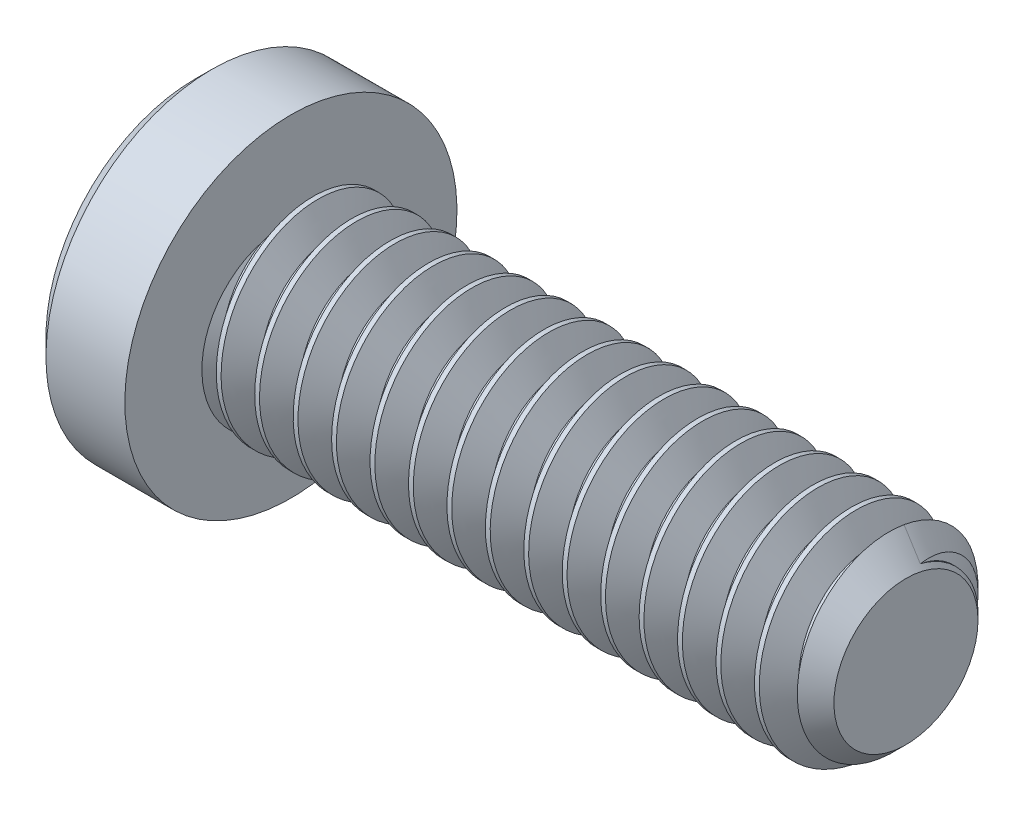
from build123d import *

# Parameters (mm, degrees)
SKETCH2_R           = 2.0828
BOSS_EXTRUDE1_DEPTH = 12.7
CHAMFER1_SIZE       = 0.5953125
CUT_SWEEP1_PITCH    = 0.79375
CUT_EXTRUDE1_DEPTH  = 1.524


with BuildPart() as part:
    # Sketch2 → Boss-Extrude1 (new body)
    with BuildSketch(Plane(origin=(6.35, 0, 0), x_dir=(0, 0, -1), z_dir=(1, 0, 0))):
        Circle(SKETCH2_R)
    extrude(amount=-BOSS_EXTRUDE1_DEPTH)

    # Chamfer1
    chamfer1_edges = [part.edges().sort_by_distance(p)[0] for p in [
        (6.35, 0, 2.0828),
    ]]
    chamfer(chamfer1_edges, length=CHAMFER1_SIZE)

    # Cut-Sweep1: the profile of Sketch5 profile screwed along a right-hand helix of 17 turns, 8 arcs to a turn; built about Z, then put on its axis
    cut_sweep1_z = Axis((0, 0, 0), (0, 0, 1))
    cut_sweep1_corners = [(2.0831, 0, 0.34743883), (2.0831, 0, -0.34743883), (1.567244252, 0, -0.049609375), (1.567244252, 0, 0.049609375)]
    with BuildLine(mode=Mode.PRIVATE) as cut_sweep1_profile:
        Line(cut_sweep1_corners[0], cut_sweep1_corners[1])
        Line(cut_sweep1_corners[1], cut_sweep1_corners[2])
        Line(cut_sweep1_corners[2], cut_sweep1_corners[3])
        Line(cut_sweep1_corners[3], cut_sweep1_corners[0])
    cut_sweep1_cap = Face(cut_sweep1_profile.wire())
    cut_sweep1_turn_angles = [0, 22.5, 45, 67.5, 90, 112.5, 135, 157.5, 180, 202.5, 225, 247.5, 270, 292.5, 315, 337.5, 360]
    cut_sweep1_turn_weights = [1, 0.9238795325112867, 1, 0.9238795325112867, 1, 0.9238795325112867, 1, 0.9238795325112867, 1, 0.9238795325112867, 1, 0.9238795325112867, 1, 0.9238795325112867, 1, 0.9238795325112867, 1]
    cut_sweep1_turn_rails = [Edge.make_bspline([Vector(p[0], p[1], 0).rotate(cut_sweep1_z, cut_sweep1_turn_angles[k]) / cut_sweep1_turn_weights[k] + Vector(0, 0, p[2] + CUT_SWEEP1_PITCH * cut_sweep1_turn_angles[k] / 360) for k in range(17)], [0, 0, 0, 1, 1, 2, 2, 3, 3, 4, 4, 5, 5, 6, 6, 7, 7, 8, 8, 8], 2, cut_sweep1_turn_weights) for p in cut_sweep1_corners]
    cut_sweep1_turn_sides = [Face.make_surface_from_curves(cut_sweep1_turn_rails[p[0]], cut_sweep1_turn_rails[p[1]]) for p in [(0, 1), (1, 2), (2, 3), (3, 0)]]
    cut_sweep1 = Plane(origin=(6.35, 0, 0), x_dir=(0, 1, 0), z_dir=(-1, 0, 0)) * Solid(Shell([*[p.moved(Location((0, 0, CUT_SWEEP1_PITCH * i))) for i in range(17) for p in cut_sweep1_turn_sides], cut_sweep1_cap, cut_sweep1_cap.rotate(cut_sweep1_z, 6120).moved(Location((0, 0, CUT_SWEEP1_PITCH * 6120 / 360)))]))
    add(cut_sweep1, mode=Mode.SUBTRACT)

    # Sketch6 → Revolve1 (revolve)
    with BuildSketch(Plane.XY, mode=Mode.PRIVATE) as revolve1_sk:
        Polygon((-7.978775, 3.429), (-8.334375, 3.0734), (-8.334375, 0), (-6.35, 0), (-6.35, 3.429), align=None)
    revolve(revolve1_sk.sketch.rotate(Axis((-6.35, 0, 0), (-1, 0, 0)), 13.865622854), axis=Axis((-6.35, 0, 0), (-1, 0, 0)))

    # Sketch4 → Cut-Extrude1 (cut)
    with BuildSketch(Plane(origin=(-8.334375, 0, 0), x_dir=(0, 0, -1), z_dir=(1, 0, 0))):
        Polygon((0, 1.14567944), (-0.9921875, 0.57283972), (-0.9921875, -0.57283972), (0, -1.14567944), (0.9921875, -0.57283972), (0.9921875, 0.57283972), align=None)
    extrude(amount=CUT_EXTRUDE1_DEPTH, mode=Mode.SUBTRACT)

    # Cut-Extrude2 cone 1 section (through the dimple's axis) → Cut-Extrude2 (revolve, cut)
    with BuildSketch(Plane(origin=(-8.334375, 0, 0), x_dir=(0, 0, 1), z_dir=(0, 1, 0))):
        Polygon((0, 0), (1.14567944, 0), (0, 1.14567944), align=None)
    revolve(axis=Axis((-8.334375, 0, 0), (1, 0, 0)), mode=Mode.SUBTRACT)


solid = part.part
